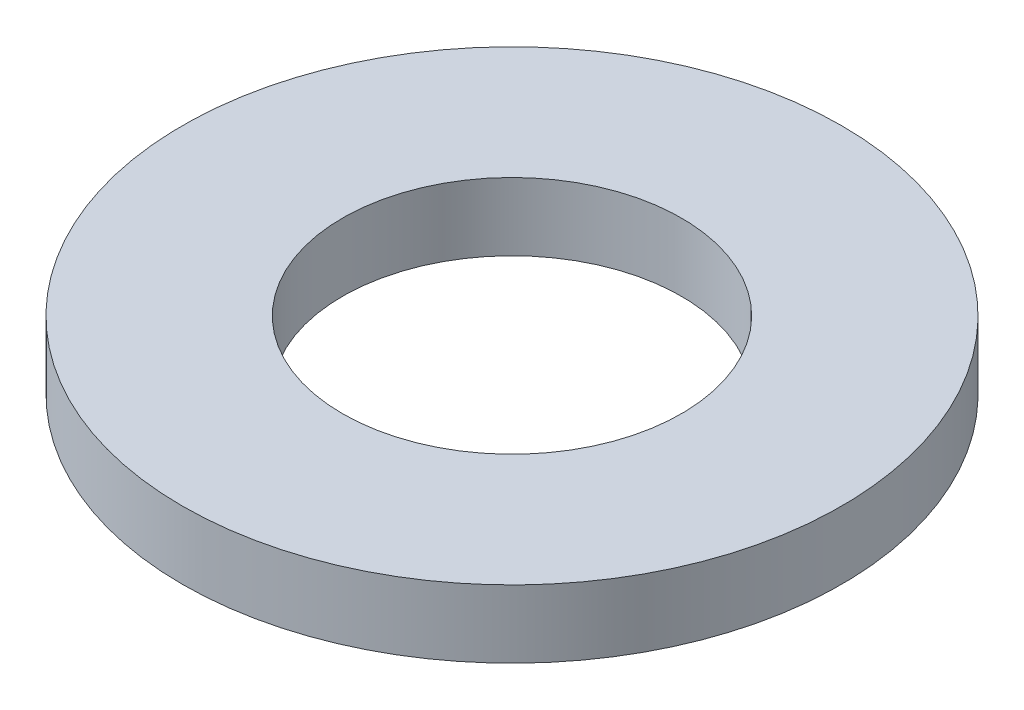
from build123d import *

# Parameters (mm, degrees)
SKETCH1_R           = 87.5
BOSS_EXTRUDE1_DEPTH = 18
SKETCH2_R           = 45
CUT_EXTRUDE1_DEPTH  = 126.045991539


with BuildPart() as part:
    # Sketch1 → Boss-Extrude1 (new body)
    with BuildSketch(Plane(origin=(0, 0, 0), x_dir=(1, 0, 0), z_dir=(0, 1, 0))):
        Circle(SKETCH1_R)
    extrude(amount=BOSS_EXTRUDE1_DEPTH)

    # Sketch2 → Cut-Extrude1 (cut, through all)
    with BuildSketch(Plane(origin=(0, 0, 0), x_dir=(1, 0, 0), z_dir=(0, 1, 0))):
        Circle(SKETCH2_R)
    extrude(amount=CUT_EXTRUDE1_DEPTH, mode=Mode.SUBTRACT)


solid = part.part
